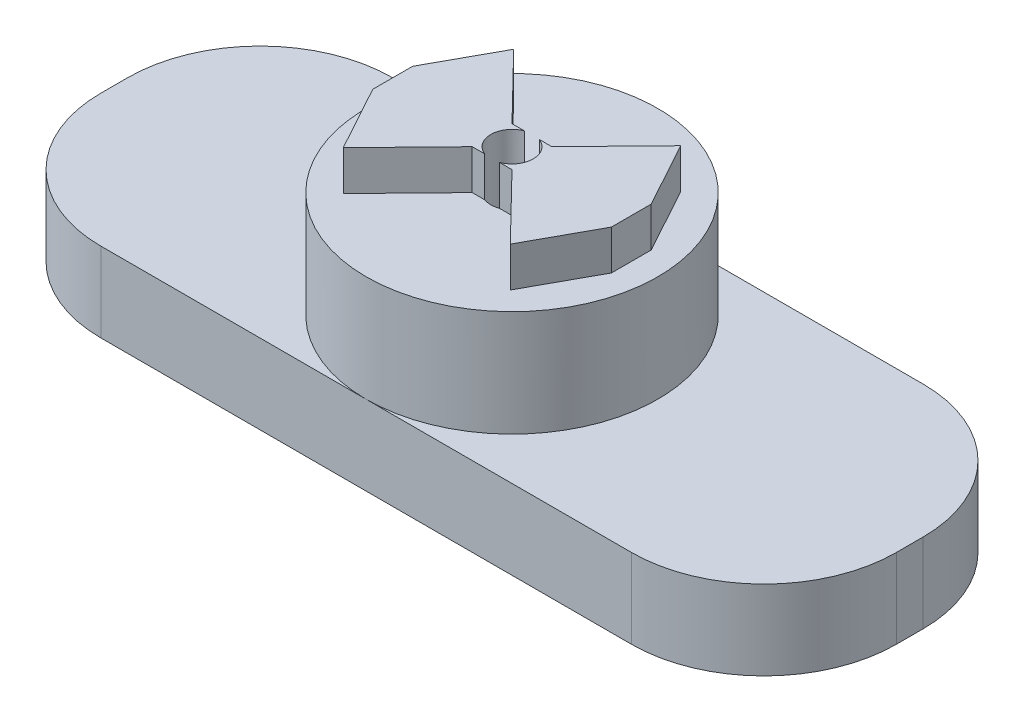
from build123d import *

# Parameters (mm, degrees)
BOSS_EXTRUDE1_DEPTH                                 = 6
SKETCH2_R                                           = 11
BOSS_EXTRUDE2_DEPTH                                 = 8
SKETCH12_R                                          = 6
CUT_EXTRUDE2_DEPTH                                  = 4
BOSS_EXTRUDE3_DEPTH                                 = 3
CSK_FOR_M3_COUNTERSUNK_FLAT_HEAD_SCREW3_D           = 3.2
CSK_FOR_M3_COUNTERSUNK_FLAT_HEAD_SCREW3_CSINK_D     = 6.3
CSK_FOR_M3_COUNTERSUNK_FLAT_HEAD_SCREW3_CSINK_ANGLE = 90


with BuildPart() as part:
    # Sketch1 → Boss-Extrude1 (new body)
    with BuildSketch(Plane(origin=(0, 0, 0), x_dir=(1, 0, 0), z_dir=(0, 1, 0))):
        with BuildLine():
            Line((-20.01, -11), (20.01, -11))
            ThreePointArc((20.01, -11), (27.073996744, -8.073996744), (30, -1.01))
            Line((30, -1.01), (30, 1.01))
            ThreePointArc((30, 1.01), (27.073996744, 8.073996744), (20.01, 11))
            Line((20.01, 11), (-20.01, 11))
            ThreePointArc((-20.01, 11), (-27.073996744, 8.073996744), (-30, 1.01))
            Line((-30, 1.01), (-30, -1.01))
            ThreePointArc((-30, -1.01), (-27.073996744, -8.073996744), (-20.01, -11))
        make_face()
    extrude(amount=BOSS_EXTRUDE1_DEPTH)

    # Sketch2 → Boss-Extrude2 (add)
    with BuildSketch(Plane(origin=(0, 6, 0), x_dir=(1, 0, 0), z_dir=(0, 1, 0))):
        Circle(SKETCH2_R)
    extrude(amount=BOSS_EXTRUDE2_DEPTH)

    # Sketch12 → Cut-Extrude2 (cut)
    with BuildSketch(Plane.XZ):
        Circle(SKETCH12_R)
    extrude(amount=-CUT_EXTRUDE2_DEPTH, mode=Mode.SUBTRACT)

    # Sketch19 → Boss-Extrude3 (add)
    with BuildSketch(Plane(origin=(0, 14, 0), x_dir=(1, 0, 0), z_dir=(0, 1, 0))):
        Polygon((-6.300393599, 6.426899758), (-9, 1.5), (-9, -1.5), (-6.300393599, -6.426899758), (-1.5, -1.5), (1.5, -1.5), (6.300393599, -6.426899758), (9, -1.5), (9, 1.5), (6.300393599, 6.426899758), (1.5, 1.5), (-1.5, 1.5), align=None)
    extrude(amount=BOSS_EXTRUDE3_DEPTH)

    # CSK for M3 Countersunk Flat Head Screw3 (through all)
    with Locations(Plane(origin=(0, 4, 0), x_dir=(-1, 0, 0), z_dir=(0, -1, 0))):
        with Locations((0, 0)):
            CounterSinkHole(CSK_FOR_M3_COUNTERSUNK_FLAT_HEAD_SCREW3_D / 2, CSK_FOR_M3_COUNTERSUNK_FLAT_HEAD_SCREW3_CSINK_D / 2, counter_sink_angle=CSK_FOR_M3_COUNTERSUNK_FLAT_HEAD_SCREW3_CSINK_ANGLE)


solid = part.part
